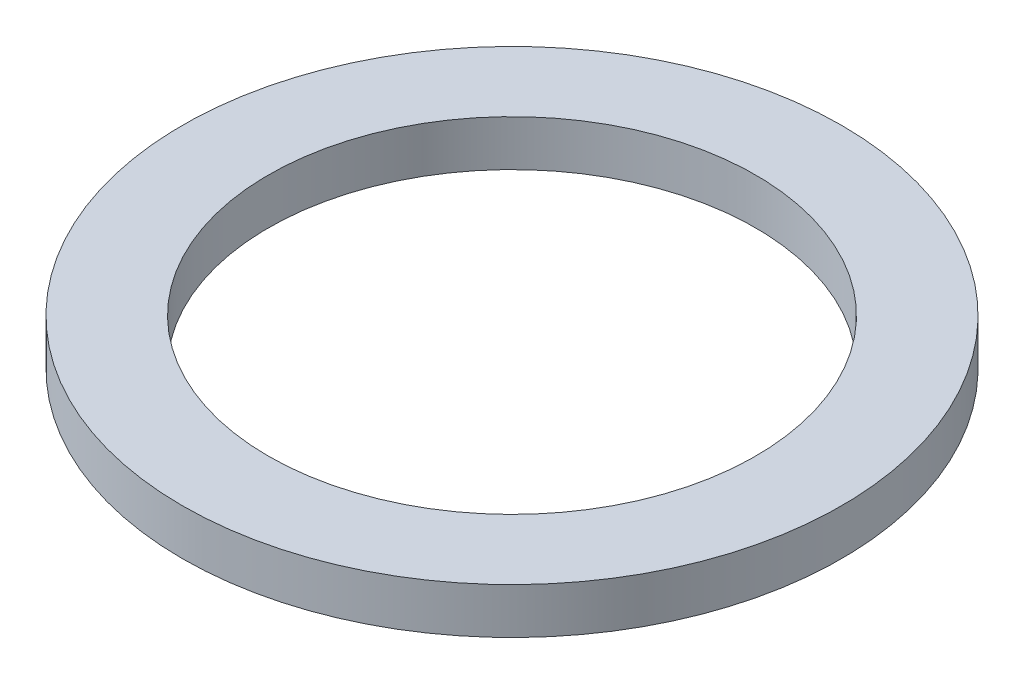
from build123d import *

# Parameters (mm, degrees)
SKETCH1_R           = 57.5
BOSS_EXTRUDE1_DEPTH = 8
SKETCH2_R           = 42.5
CUT_EXTRUDE1_DEPTH  = 82.709852527


with BuildPart() as part:
    # Sketch1 → Boss-Extrude1 (new body)
    with BuildSketch(Plane(origin=(0, 0, 0), x_dir=(1, 0, 0), z_dir=(0, 1, 0))):
        Circle(SKETCH1_R)
    extrude(amount=BOSS_EXTRUDE1_DEPTH)

    # Sketch2 → Cut-Extrude1 (cut, through all)
    with BuildSketch(Plane(origin=(0, 0, 0), x_dir=(1, 0, 0), z_dir=(0, 1, 0))):
        Circle(SKETCH2_R)
    extrude(amount=CUT_EXTRUDE1_DEPTH, mode=Mode.SUBTRACT)


solid = part.part
